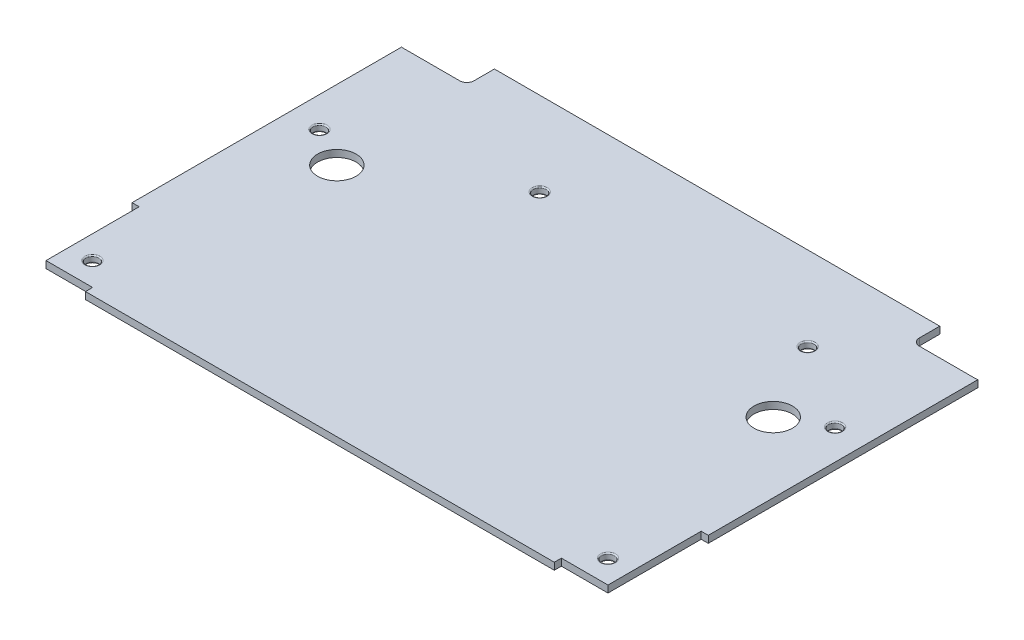
from build123d import *

# Parameters (mm, degrees)
SKETCH1_W           = 247.3
SKETCH1_H           = 170.475
BOSS_EXTRUDE1_DEPTH = 3
CUT_EXTRUDE2_DEPTH  = 151.212362694
SKETCH2_R           = 2.75
CUT_EXTRUDE1_DEPTH  = 151.212362694
FILLET1_R           = 0.5
SKETCH10_R          = 2.75
CUT_EXTRUDE8_DEPTH  = 151.212362694
FILLET4_R           = 0.5
CUT_EXTRUDE11_DEPTH = 151.212362694
SKETCH14_R          = 8.255
CUT_EXTRUDE12_DEPTH = 151.212362694


with BuildPart() as part:
    # Sketch1 → Boss-Extrude1 (new body)
    with BuildSketch(Plane(origin=(0, 0, 0), x_dir=(1, 0, 0), z_dir=(0, 1, 0))):
        Rectangle(SKETCH1_W, SKETCH1_H)
    extrude(amount=BOSS_EXTRUDE1_DEPTH)

    # Sketch4 → Cut-Extrude2 (cut, through all)
    with BuildSketch(Plane(origin=(0, 3, 0), x_dir=(1, 0, 0), z_dir=(0, 1, 0))):
        Polygon((-123.65, -85.2375), (-120.6, -85.2375), (-100.6, -85.2375), (-100.6, -82.1875), (-120.6, -82.1875), (-120.6, -42.1875), (-123.65, -42.1875), align=None)
        Polygon((100.6, -85.2375), (100.6, -82.1875), (120.6, -82.1875), (120.6, -42.1875), (123.65, -42.1875), (123.65, -85.2375), (120.6, -85.2375), align=None)
    extrude(amount=-CUT_EXTRUDE2_DEPTH, mode=Mode.SUBTRACT)

    # Sketch2 → Cut-Extrude1 (cut, through all)
    with BuildSketch(Plane(origin=(0, 3, 0), x_dir=(1, 0, 0), z_dir=(0, 1, 0))):
        with Locations((-110.65, 25.2375)):
            Circle(SKETCH2_R)
        with Locations((110.65, 25.2375)):
            Circle(SKETCH2_R)
        with Locations((-110.65, -72.2375)):
            Circle(SKETCH2_R)
        with Locations((110.65, -72.2375)):
            Circle(SKETCH2_R)
    extrude(amount=-CUT_EXTRUDE1_DEPTH, mode=Mode.SUBTRACT)

    # Fillet1
    fillet1_edges = [part.edges().sort_by_distance(p)[0] for p in [
        (-113.4, 3, -25.2375),
        (-113.4, 0, -25.2375),
        (107.9, 3, -25.2375),
        (107.9, 0, -25.2375),
        (-113.4, 3, 72.2375),
        (-113.4, 0, 72.2375),
        (107.9, 3, 72.2375),
        (107.9, 0, 72.2375),
    ]]
    fillet(fillet1_edges, radius=FILLET1_R)

    # Sketch10 → Cut-Extrude8 (cut, through all)
    with BuildSketch(Plane(origin=(0, 3, 0), x_dir=(1, 0, 0), z_dir=(0, 1, 0))):
        with Locations((74.85, 49.2625)):
            Circle(SKETCH10_R)
        with Locations((-40.15, 49.2625)):
            Circle(SKETCH10_R)
    extrude(amount=-CUT_EXTRUDE8_DEPTH, mode=Mode.SUBTRACT)

    # Fillet4
    fillet4_edges = [part.edges().sort_by_distance(p)[0] for p in [
        (-42.9, 3, -49.2625),
        (-42.9, 0, -49.2625),
        (72.1, 3, -49.2625),
        (72.1, 0, -49.2625),
    ]]
    fillet(fillet4_edges, radius=FILLET4_R)

    # Sketch13 → Cut-Extrude11 (cut, through all)
    with BuildSketch(Plane.XZ):
        with BuildLine():
            Line((122.675, -73.4145), (98.625, -73.4145))
            ThreePointArc((98.625, -73.4145), (96.468324317, -74.307824317), (95.575, -76.4645))
            Line((95.575, -76.4645), (95.575, -133.9645))
            ThreePointArc((95.575, -133.9645), (96.468324317, -136.121175683), (98.625, -137.0145))
            Line((98.625, -137.0145), (122.675, -137.0145))
            ThreePointArc((122.675, -137.0145), (124.831675683, -136.121175683), (125.725, -133.9645))
            Line((125.725, -133.9645), (125.725, -76.4645))
            ThreePointArc((125.725, -76.4645), (124.831675683, -74.307824317), (122.675, -73.4145))
        make_face()
        with BuildLine():
            Line((-98.625, -73.4145), (-122.675, -73.4145))
            ThreePointArc((-122.675, -73.4145), (-124.831675683, -74.307824317), (-125.725, -76.4645))
            Line((-125.725, -76.4645), (-125.725, -133.9645))
            ThreePointArc((-125.725, -133.9645), (-124.831675683, -136.121175683), (-122.675, -137.0145))
            Line((-122.675, -137.0145), (-98.625, -137.0145))
            ThreePointArc((-98.625, -137.0145), (-96.468324317, -136.121175683), (-95.575, -133.9645))
            Line((-95.575, -133.9645), (-95.575, -76.4645))
            ThreePointArc((-95.575, -76.4645), (-96.468324317, -74.307824317), (-98.625, -73.4145))
        make_face()
    extrude(amount=-CUT_EXTRUDE11_DEPTH, mode=Mode.SUBTRACT)

    # Sketch14 → Cut-Extrude12 (cut, through all)
    with BuildSketch(Plane(origin=(0, 3, 0), x_dir=(1, 0, 0), z_dir=(0, 1, 0))):
        with Locations((-93.65, 15.693519464)):
            Circle(SKETCH14_R)
        with Locations((93.65, 15.693519464)):
            Circle(SKETCH14_R)
    extrude(amount=-CUT_EXTRUDE12_DEPTH, mode=Mode.SUBTRACT)


solid = part.part
